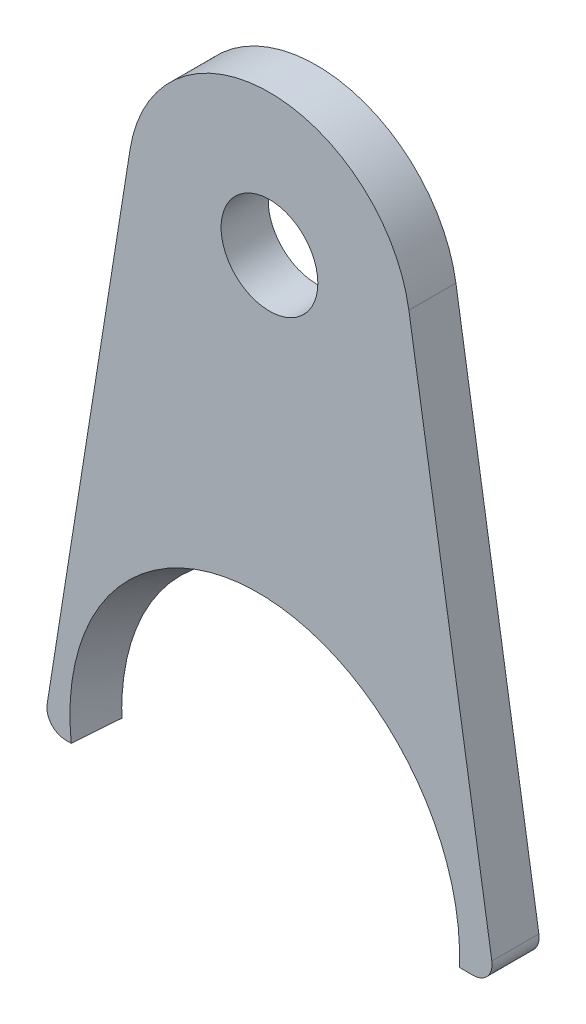
from build123d import *

# Parameters (mm, degrees)
SKETCH1_R           = 3.2639
BOSS_EXTRUDE1_DEPTH = 3.175
CAVITY1_START       = 3.689049998
CAVITY1_DEPTH       = 9.603434939
FILLET3_R           = 1.27


# Read off the part's stored shape, not the designer's step: Cavity1
with BuildPart() as part:
    # Sketch1 → Boss-Extrude1 (new body)
    with BuildSketch(Plane.XY):
        with BuildLine():
            ThreePointArc((9.406966983, 1.494856913), (0, 9.525), (-9.406966983, 1.494856913))
            Line((-9.406966983, 1.494856913), (-15.24, -35.211766))
            Line((-15.24, -35.211766), (15.24, -35.211766))
            Line((15.24, -35.211766), (9.406966983, 1.494856913))
        make_face()
        Circle(SKETCH1_R, mode=Mode.SUBTRACT)
    extrude(amount=BOSS_EXTRUDE1_DEPTH)

    # Cavity1 outline → Cavity1 (cut)
    with BuildSketch(Plane(origin=(0, 0, 0), x_dir=(0.9955947349362284, 0.032256539947670526, 0.08803771576924041), z_dir=(0.09376099278090663, -0.3425138790307331, -0.9348225066311033)).offset(CAVITY1_START)):
        with BuildLine():
            Line((-14.012226084, 36), (-14.169183947, 34.154693399))
            ThreePointArc((-14.169183947, 34.154693399), (-1.135248211, 19.965054491), (11.898687525, 34.154693399))
            Line((11.898687525, 34.154693399), (11.741729662, 36))
            Line((11.741729662, 36), (-14.012226084, 36))
        make_face()
    extrude(amount=CAVITY1_DEPTH, mode=Mode.SUBTRACT)

    # Fillet3
    fillet3_edges = [part.edges().sort_by_distance(p)[0] for p in [
        (-15.24, -35.211766, 1.5875),
        (15.24, -35.211766, 1.5875),
    ]]
    fillet(fillet3_edges, radius=FILLET3_R)


solid = part.part
